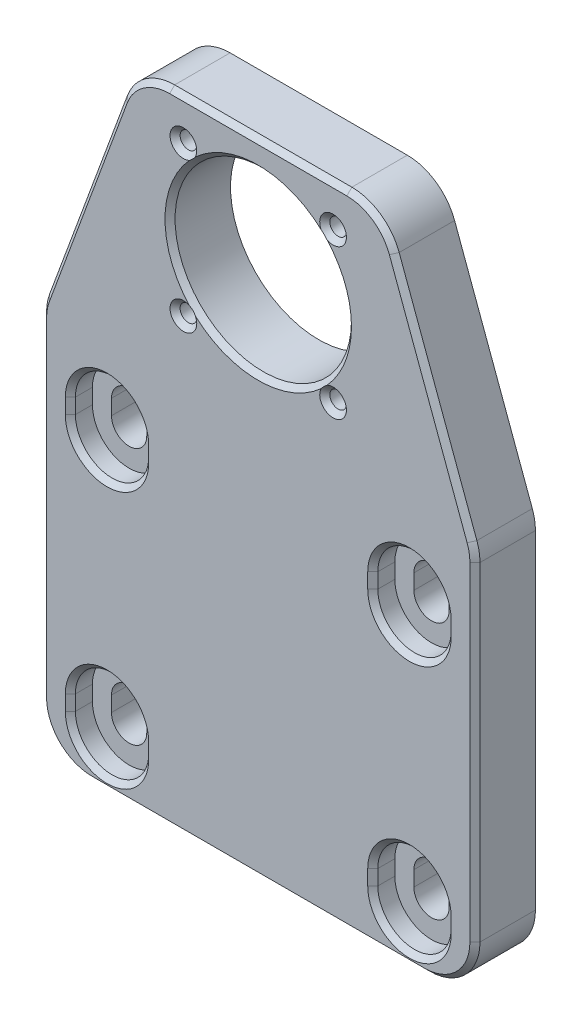
from build123d import *

# Parameters (mm, degrees)
SKETCH1_W                                = 86
SKETCH1_H                                = 77
SKETCH1_R                                = 17.5
BOSS_EXTRUDE1_DEPTH                      = 12
CBORE_START                              = 7.62
CBORE_SLOT_FOR_M6_HEX_HEAD_BOLT1_DEPTH   = 4.38
CBORE_SLOT_FOR_M6_HEX_HEAD_BOLT1_2_DEPTH = 7.62
M4X0_7_TAPPED_HOLE1_D                    = 3.3
M4X0_7_TAPPED_HOLE1_DEPTH                = 17.1
M4X0_7_TAPPED_HOLE1_TIP                  = 0.991420021
FILLET1_R                                = 10
CHAMFER1_SIZE                            = 1


# Read off the part's stored shape, not the designer's step: CBORE SLOT for M6 Hex Head Bolt1
with BuildPart() as part:
    # Sketch1 → Boss-Extrude1 (new body)
    # profile 1 of 2: a face of its own
    with BuildSketch(Plane.XY):
        with Locations((0, 40.5)):
            Rectangle(SKETCH1_W, SKETCH1_H)
    # profile 2 of 2: a face of its own
    with BuildSketch(Plane.XY):
        Polygon((-27.043146614, 122.240902798), (-43, 79), (43, 79), (27.043146614, 122.240902798), (24.548889647, 129), (-24.548889647, 129), align=None)
        with Locations((0, 106)):
            Circle(SKETCH1_R, mode=Mode.SUBTRACT)
    extrude(amount=BOSS_EXTRUDE1_DEPTH)

    # CBORE SLOT for M6 Hex Head Bolt1 outline → CBORE SLOT for M6 Hex Head Bolt1 (cut)
    with BuildSketch(Plane.XY.offset(CBORE_START)):
        with BuildLine():
            Line((-22.725, 11.5), (-22.725, 14.5))
            ThreePointArc((-22.725, 14.5), (-30, 21.775), (-37.275, 14.5))
            Line((-37.275, 14.5), (-37.275, 11.5))
            ThreePointArc((-37.275, 11.5), (-30, 4.225), (-22.725, 11.5))
        make_face()
        with BuildLine():
            ThreePointArc((-22.725, 65.5), (-30, 72.775), (-37.275, 65.5))
            Line((-37.275, 65.5), (-37.275, 62.5))
            ThreePointArc((-37.275, 62.5), (-30, 55.225), (-22.725, 62.5))
            Line((-22.725, 62.5), (-22.725, 65.5))
        make_face()
        with BuildLine():
            Line((37.275, 11.5), (37.275, 14.5))
            ThreePointArc((37.275, 14.5), (30, 21.775), (22.725, 14.5))
            Line((22.725, 14.5), (22.725, 11.5))
            ThreePointArc((22.725, 11.5), (30, 4.225), (37.275, 11.5))
        make_face()
        with BuildLine():
            ThreePointArc((37.275, 65.5), (30, 72.775), (22.725, 65.5))
            Line((22.725, 65.5), (22.725, 62.5))
            ThreePointArc((22.725, 62.5), (30, 55.225), (37.275, 62.5))
            Line((37.275, 62.5), (37.275, 65.5))
        make_face()
    extrude(amount=CBORE_SLOT_FOR_M6_HEX_HEAD_BOLT1_DEPTH, mode=Mode.SUBTRACT)

    # CBORE SLOT for M6 Hex Head Bolt1 2 outli → CBORE SLOT for M6 Hex Head Bolt1 2 (cut)
    with BuildSketch(Plane.XY):
        with BuildLine():
            Line((-26.5, 11.5), (-26.5, 14.5))
            ThreePointArc((-26.5, 14.5), (-30, 18), (-33.5, 14.5))
            Line((-33.5, 14.5), (-33.5, 11.5))
            ThreePointArc((-33.5, 11.5), (-30, 8), (-26.5, 11.5))
        make_face()
        with BuildLine():
            ThreePointArc((-33.5, 62.5), (-30, 59), (-26.5, 62.5))
            Line((-26.5, 62.5), (-26.5, 65.5))
            ThreePointArc((-26.5, 65.5), (-30, 69), (-33.5, 65.5))
            Line((-33.5, 65.5), (-33.5, 62.5))
        make_face()
        with BuildLine():
            Line((33.5, 11.5), (33.5, 14.5))
            ThreePointArc((33.5, 14.5), (30, 18), (26.5, 14.5))
            Line((26.5, 14.5), (26.5, 11.5))
            ThreePointArc((26.5, 11.5), (30, 8), (33.5, 11.5))
        make_face()
        with BuildLine():
            ThreePointArc((33.5, 65.5), (30, 69), (26.5, 65.5))
            Line((26.5, 65.5), (26.5, 62.5))
            ThreePointArc((26.5, 62.5), (30, 59), (33.5, 62.5))
            Line((33.5, 62.5), (33.5, 65.5))
        make_face()
    extrude(amount=CBORE_SLOT_FOR_M6_HEX_HEAD_BOLT1_2_DEPTH, mode=Mode.SUBTRACT)

    # M4x0.7 Tapped Hole1
    with Locations(Plane(origin=(-14.849242405, 120.849242405, 12), x_dir=(1, 0, 0), z_dir=(0, 0, 1))):
        with Locations((0, 0), (29.69848481, 0), (29.69848481, -29.69848481), (0, -29.69848481)):
            Hole(M4X0_7_TAPPED_HOLE1_D / 2, depth=M4X0_7_TAPPED_HOLE1_DEPTH)
            with Locations((0, 0, -(M4X0_7_TAPPED_HOLE1_DEPTH + M4X0_7_TAPPED_HOLE1_TIP / 2))):  # 118° drill point
                Cone(0, M4X0_7_TAPPED_HOLE1_D / 2, M4X0_7_TAPPED_HOLE1_TIP, mode=Mode.SUBTRACT)

    # Fillet1
    fillet1_edges = [part.edges().sort_by_distance(p)[0] for p in [
        (-24.548889647, 129, 6),
        (24.548889647, 129, 6),
        (43, 79, 6),
        (43, 2, 6),
        (-43, 2, 6),
        (-43, 79, 6),
    ]]
    fillet(fillet1_edges, radius=FILLET1_R)

    # Chamfer1
    # the kernel refuses this chamfer: 1 mm, written as the material it takes off along each edge
    with BuildSketch(Plane(origin=(-22.725, 62.5, 12), x_dir=(0.9996219169112968, 0, 0.027495876610585647), z_dir=(0, 1, 0)), Plane(origin=(-37.275, 65.5, 12), x_dir=(-0.9996219169112968, 0, 0.02749587661058555), z_dir=(0, -1, 0)), Plane(origin=(-22.725, 11.5, 12), x_dir=(0.9996219169112968, 0, 0.027495876610585647), z_dir=(0, 1, 0)), Plane(origin=(-37.275, 14.5, 12), x_dir=(-0.9996219169112968, 0, 0.02749587661058555), z_dir=(0, -1, 0)), Plane(origin=(37.275, 11.5, 12), x_dir=(0.9996219169112968, 0, 0.02749587661058555), z_dir=(0, 1, 0)), Plane(origin=(22.725, 14.5, 12), x_dir=(-0.9996219169112968, 0, 0.027495876610585647), z_dir=(0, -1, 0)), Plane(origin=(37.275, 62.5, 12), x_dir=(0.9996219169112968, 0, 0.02749587661058555), z_dir=(0, 1, 0)), Plane(origin=(22.725, 65.5, 12), x_dir=(-0.9996219169112968, 0, 0.027495876610585647), z_dir=(0, -1, 0))) as chamfer1_piece_1:
        Polygon((CHAMFER1_SIZE * 0.999621916911, CHAMFER1_SIZE * 0.0274958766106), (-CHAMFER1_SIZE * 0.0274958766106, CHAMFER1_SIZE * 0.999621916911), (0, 0), align=None)
    extrude(amount=3, mode=Mode.SUBTRACT)
    with BuildSketch(Plane(origin=(-30, 65.5, 12), x_dir=(1, 0, 0), z_dir=(0, -1, 0))) as chamfer1_piece_2:
        Polygon((7.275 + CHAMFER1_SIZE, 0), (7.275, -CHAMFER1_SIZE), (7.275, 0), align=None)
    revolve(axis=Axis((-30, 65.5, 12), (0, 0, 1)), revolution_arc=180, mode=Mode.SUBTRACT)
    with BuildSketch(Plane(origin=(-30, 62.5, 12), x_dir=(-1, 0, 0), z_dir=(0, 1, 0))) as chamfer1_piece_3:
        Polygon((7.275 + CHAMFER1_SIZE, 0), (7.275, -CHAMFER1_SIZE), (7.275, 0), align=None)
    revolve(axis=Axis((-30, 62.5, 12), (0, 0, 1)), revolution_arc=180, mode=Mode.SUBTRACT)
    with BuildSketch(Plane(origin=(-14.849242405, 91.150757595, 12), x_dir=(-1, 0, 0), z_dir=(0, -1, 0))) as chamfer1_piece_4:
        Polygon((1.65 + CHAMFER1_SIZE, 0), (1.65, CHAMFER1_SIZE), (1.65, 0), align=None)
    revolve(axis=Axis((-14.849242405, 91.150757595, 12), (0, 0, -1)), mode=Mode.SUBTRACT)
    with BuildSketch(Plane(origin=(14.849242405, 91.150757595, 12), x_dir=(-1, 0, 0), z_dir=(0, -1, 0))) as chamfer1_piece_5:
        Polygon((1.65 + CHAMFER1_SIZE, 0), (1.65, CHAMFER1_SIZE), (1.65, 0), align=None)
    revolve(axis=Axis((14.849242405, 91.150757595, 12), (0, 0, -1)), mode=Mode.SUBTRACT)
    with BuildSketch(Plane(origin=(14.849242405, 120.849242405, 12), x_dir=(-1, 0, 0), z_dir=(0, -1, 0))) as chamfer1_piece_6:
        Polygon((1.65 + CHAMFER1_SIZE, 0), (1.65, CHAMFER1_SIZE), (1.65, 0), align=None)
    revolve(axis=Axis((14.849242405, 120.849242405, 12), (0, 0, -1)), mode=Mode.SUBTRACT)
    with BuildSketch(Plane(origin=(-14.849242405, 120.849242405, 12), x_dir=(-1, 0, 0), z_dir=(0, -1, 0))) as chamfer1_piece_7:
        Polygon((1.65 + CHAMFER1_SIZE, 0), (1.65, CHAMFER1_SIZE), (1.65, 0), align=None)
    revolve(axis=Axis((-14.849242405, 120.849242405, 12), (0, 0, -1)), mode=Mode.SUBTRACT)
    with BuildSketch(Plane(origin=(-33, 2, 12), x_dir=(0, 0.9996219169112968, 0.027495876610585623), z_dir=(1, 0, 0))) as chamfer1_piece_8:
        Polygon((CHAMFER1_SIZE * 0.999621916911, -CHAMFER1_SIZE * 0.0274958766106), (-CHAMFER1_SIZE * 0.0274958766106, -CHAMFER1_SIZE * 0.999621916911), (0, 0), align=None)
    extrude(amount=66, mode=Mode.SUBTRACT)
    with BuildSketch(Plane(origin=(-43, 77.213760058, 12), x_dir=(-0.0274958766105891, 0, -0.9996219169112968), z_dir=(0, -1, 0))) as chamfer1_piece_9:
        Polygon((CHAMFER1_SIZE * 0.999621916911, CHAMFER1_SIZE * 0.0274958766106), (-CHAMFER1_SIZE * 0.0274958766106, CHAMFER1_SIZE * 0.999621916911), (0, 0), align=None)
    extrude(amount=65.213760058, mode=Mode.SUBTRACT)
    with BuildSketch(Plane(origin=(-42.381600361, 80.675778929, 12), x_dir=(0.9378053336703238, -0.3460709940299939, 0.0274958766105856), z_dir=(0.34620188710878685, 0.938160036114476, 0)), Plane(origin=(26.961549873, 122.462018871, 12), x_dir=(-0.9378053336703737, -0.3460709940298588, 0.027495876610585664), z_dir=(0.34620188710865174, -0.9381600361145258, 0))) as chamfer1_piece_10:
        Polygon((CHAMFER1_SIZE * 0.999621916911, CHAMFER1_SIZE * 0.0274958766106), (-CHAMFER1_SIZE * 0.0274958766106, CHAMFER1_SIZE * 0.999621916911), (0, 0), align=None)
    extrude(amount=44.540630952, mode=Mode.SUBTRACT)
    with BuildSketch(Plane(origin=(43, 12, 12), x_dir=(-0.9996219169112968, 0, 0.02749587661058555), z_dir=(0, 1, 0))) as chamfer1_piece_11:
        Polygon((CHAMFER1_SIZE * 0.999621916911, -CHAMFER1_SIZE * 0.0274958766106), (-CHAMFER1_SIZE * 0.0274958766106, -CHAMFER1_SIZE * 0.999621916911), (0, 0), align=None)
    extrude(amount=65.213760058, mode=Mode.SUBTRACT)
    with BuildSketch(Plane(origin=(17.579949511, 129, 12), x_dir=(0, -0.9996219169112968, 0.02749587661058574), z_dir=(-1, 0, 0))) as chamfer1_piece_12:
        Polygon((CHAMFER1_SIZE * 0.999621916911, -CHAMFER1_SIZE * 0.0274958766106), (-CHAMFER1_SIZE * 0.0274958766106, -CHAMFER1_SIZE * 0.999621916911), (0, 0), align=None)
    extrude(amount=35.159899023, mode=Mode.SUBTRACT)
    with BuildSketch(Plane(origin=(17.579949511, 119, 12), x_dir=(0, 1, 0), z_dir=(-1, 0, 0))) as chamfer1_piece_13:
        Polygon((10 - CHAMFER1_SIZE, 0), (10, CHAMFER1_SIZE), (10, 0), align=None)
    revolve(axis=Axis((17.579949511, 119, 12), (0, 0, -1)), revolution_arc=69.744819304, mode=Mode.SUBTRACT)
    with BuildSketch(Plane(origin=(-17.579949511, 119, 12), x_dir=(-0.9381600361144766, 0.34620188710878497, 0), z_dir=(-0.34620188710878497, -0.9381600361144766, 0))) as chamfer1_piece_14:
        Polygon((10 - CHAMFER1_SIZE, 0), (10, CHAMFER1_SIZE), (10, 0), align=None)
    revolve(axis=Axis((-17.579949511, 119, 12), (0, 0, -1)), revolution_arc=69.744819304, mode=Mode.SUBTRACT)
    with BuildSketch(Plane(origin=(-33, 77.213760058, 12), x_dir=(-1, 0, 0), z_dir=(0, -1, 0))) as chamfer1_piece_15:
        Polygon((10, CHAMFER1_SIZE), (10 - CHAMFER1_SIZE, 0), (10, 0), align=None)
    revolve(axis=Axis((-33, 77.213760058, 12), (0, 0, -1)), revolution_arc=20.255180696, mode=Mode.SUBTRACT)
    with BuildSketch(Plane(origin=(33, 77.213760058, 12), x_dir=(1, 0, 0), z_dir=(0, -1, 0))) as chamfer1_piece_16:
        Polygon((10 - CHAMFER1_SIZE, 0), (10, -CHAMFER1_SIZE), (10, 0), align=None)
    revolve(axis=Axis((33, 77.213760058, 12), (0, 0, 1)), revolution_arc=20.255180696, mode=Mode.SUBTRACT)
    with BuildSketch(Plane(origin=(33, 12, 12), x_dir=(0, -1, 0), z_dir=(-1, 0, 0))) as chamfer1_piece_17:
        Polygon((10 - CHAMFER1_SIZE, 0), (10, -CHAMFER1_SIZE), (10, 0), align=None)
    revolve(axis=Axis((33, 12, 12), (0, 0, 1)), revolution_arc=90, mode=Mode.SUBTRACT)
    with BuildSketch(Plane(origin=(-33, 12, 12), x_dir=(-1, 0, 0), z_dir=(0, 1, 0))) as chamfer1_piece_18:
        Polygon((10, -CHAMFER1_SIZE), (10 - CHAMFER1_SIZE, 0), (10, 0), align=None)
    revolve(axis=Axis((-33, 12, 12), (0, 0, 1)), revolution_arc=90, mode=Mode.SUBTRACT)
    with BuildSketch(Plane(origin=(-30, 14.5, 12), x_dir=(1, 0, 0), z_dir=(0, -1, 0))) as chamfer1_piece_19:
        Polygon((7.275 + CHAMFER1_SIZE, 0), (7.275, -CHAMFER1_SIZE), (7.275, 0), align=None)
    revolve(axis=Axis((-30, 14.5, 12), (0, 0, 1)), revolution_arc=180, mode=Mode.SUBTRACT)
    with BuildSketch(Plane(origin=(-30, 11.5, 12), x_dir=(-1, 0, 0), z_dir=(0, 1, 0))) as chamfer1_piece_20:
        Polygon((7.275 + CHAMFER1_SIZE, 0), (7.275, -CHAMFER1_SIZE), (7.275, 0), align=None)
    revolve(axis=Axis((-30, 11.5, 12), (0, 0, 1)), revolution_arc=180, mode=Mode.SUBTRACT)
    with BuildSketch(Plane(origin=(30, 14.5, 12), x_dir=(1, 0, 0), z_dir=(0, -1, 0))) as chamfer1_piece_21:
        Polygon((7.275 + CHAMFER1_SIZE, 0), (7.275, -CHAMFER1_SIZE), (7.275, 0), align=None)
    revolve(axis=Axis((30, 14.5, 12), (0, 0, 1)), revolution_arc=180, mode=Mode.SUBTRACT)
    with BuildSketch(Plane(origin=(30, 11.5, 12), x_dir=(-1, 0, 0), z_dir=(0, 1, 0))) as chamfer1_piece_22:
        Polygon((7.275 + CHAMFER1_SIZE, 0), (7.275, -CHAMFER1_SIZE), (7.275, 0), align=None)
    revolve(axis=Axis((30, 11.5, 12), (0, 0, 1)), revolution_arc=180, mode=Mode.SUBTRACT)
    with BuildSketch(Plane(origin=(0, 106, 12), x_dir=(1, 0, 0), z_dir=(0, -1, 0))) as chamfer1_piece_23:
        Polygon((17.5 + CHAMFER1_SIZE, 0), (17.5, -CHAMFER1_SIZE), (17.5, 0), align=None)
    revolve(axis=Axis((0, 106, 12), (0, 0, 1)), mode=Mode.SUBTRACT)
    with BuildSketch(Plane(origin=(30, 65.5, 12), x_dir=(1, 0, 0), z_dir=(0, -1, 0))) as chamfer1_piece_24:
        Polygon((7.275 + CHAMFER1_SIZE, 0), (7.275, -CHAMFER1_SIZE), (7.275, 0), align=None)
    revolve(axis=Axis((30, 65.5, 12), (0, 0, 1)), revolution_arc=180, mode=Mode.SUBTRACT)
    with BuildSketch(Plane(origin=(30, 62.5, 12), x_dir=(-1, 0, 0), z_dir=(0, 1, 0))) as chamfer1_piece_25:
        Polygon((7.275 + CHAMFER1_SIZE, 0), (7.275, -CHAMFER1_SIZE), (7.275, 0), align=None)
    revolve(axis=Axis((30, 62.5, 12), (0, 0, 1)), revolution_arc=180, mode=Mode.SUBTRACT)


solid = part.part
